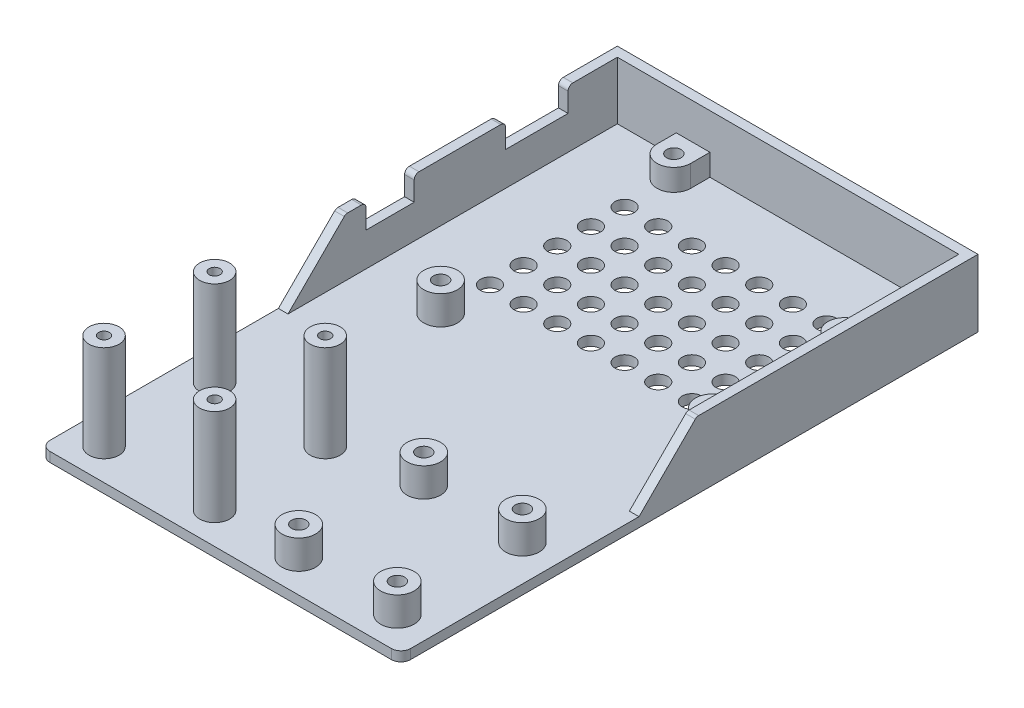
from build123d import *

# Parameters (mm, degrees)
SKETCH1_W                = 70
SKETCH1_H                = 100
BOSS_EXTRUDE1_DEPTH      = 2
SKETCH2_R                = 3.5
SKETCH2_R_2              = 1.5
BOSS_EXTRUDE2_DEPTH      = 6
BOSS_EXTRUDE3_START      = -2
SKETCH3_R                = 3.5
BOSS_EXTRUDE3_DEPTH      = 2
BOSS_EXTRUDE4_DEPTH      = 12
BOSS_EXTRUDE4_DEPTH_BACK = 2
SKETCH4_W                = 75
SKETCH4_H                = 105
SKETCH4_W_2              = 71
SKETCH4_H_2              = 101
BOSS_EXTRUDE5_DEPTH      = 6
SKETCH8_W                = 75
SKETCH8_H                = 46.5
CUT_EXTRUDE1_DEPTH       = 66.623928563
SKETCH9_W                = 2
SKETCH9_H                = 13
SKETCH9_H_2              = 10
CUT_EXTRUDE2_DEPTH       = 5
CHAMFER1_SIZE            = 12
FILLET2_START            = -38
FILLET2_DEPTH            = 73.5
FILLET2_START_2          = -35.5
FILLET2_2_DEPTH          = 73.5
SKETCH10_R               = 3.5
SKETCH10_R_2             = 1.5
BOSS_EXTRUDE6_DEPTH      = 6
SKETCH11_R               = 3.125
SKETCH11_R_2             = 1.125
BOSS_EXTRUDE7_DEPTH      = 20
SKETCH12_R               = 2
CUT_EXTRUDE3_DEPTH       = 78.034489029
SKETCH14_W               = 75
SKETCH14_H               = 15
BOSS_EXTRUDE8_DEPTH      = 2
FILLET3_R                = 2
CUT_EXTRUDE4_DEPTH       = 1.5


with BuildPart() as part:
    # Sketch1 → Boss-Extrude1 (new body)
    with BuildSketch(Plane(origin=(0, 0, 0), x_dir=(1, 0, 0), z_dir=(0, 1, 0))):
        Rectangle(SKETCH1_W, SKETCH1_H)
    extrude(amount=BOSS_EXTRUDE1_DEPTH)

    # Sketch2 → Boss-Extrude2 (add)
    # profile 1 of 4: a face of its own
    with BuildSketch(Plane(origin=(0, 2, 0), x_dir=(1, 0, 0), z_dir=(0, 1, 0))):
        with Locations(Location((-19.75, 46.5, 0), (0, 0, 90))):
            Circle(SKETCH2_R)
        with Locations(Location((-19.75, 46.5, 0), (0, 0, 270))):
            Circle(SKETCH2_R_2, mode=Mode.SUBTRACT)
    # profile 2 of 4: a face of its own
    with BuildSketch(Plane(origin=(0, 2, 0), x_dir=(1, 0, 0), z_dir=(0, 1, 0))):
        with Locations((31.5, 30.75)):
            Circle(SKETCH2_R)
        with Locations(Location((31.5, 30.75, 0), (0, 0, 270))):
            Circle(SKETCH2_R_2, mode=Mode.SUBTRACT)
    # profile 3 of 4: a face of its own
    with BuildSketch(Plane(origin=(0, 2, 0), x_dir=(1, 0, 0), z_dir=(0, 1, 0))):
        with Locations((31.5, 3.25)):
            Circle(SKETCH2_R)
        with Locations(Location((31.5, 3.25, 0), (0, 0, 270))):
            Circle(SKETCH2_R_2, mode=Mode.SUBTRACT)
    # profile 4 of 4: a face of its own
    with BuildSketch(Plane(origin=(0, 2, 0), x_dir=(1, 0, 0), z_dir=(0, 1, 0))):
        with Locations(Location((-19.75, -2, 0), (0, 0, 270))):
            Circle(SKETCH2_R)
        with Locations(Location((-19.75, -2, 0), (0, 0, 270))):
            Circle(SKETCH2_R_2, mode=Mode.SUBTRACT)
    extrude(amount=BOSS_EXTRUDE2_DEPTH)

    # Sketch3 → Boss-Extrude3 (add)
    # profile 1 of 4: a face of its own
    with BuildSketch(Plane(origin=(0, 2, 0), x_dir=(1, 0, 0), z_dir=(0, 1, 0)).offset(BOSS_EXTRUDE3_START)):
        Polygon((-19.75, 50.5), (-35.5, 50.5), (-35.5, -50.5), (35.5, -50.5), (35.5, 3.25), (35.5, 50.5), align=None)
        Polygon((35, -50), (35, 3.25), (35, 30.75), (35, 50), (-19.75, 50), (-35, 50), (-35, -50), align=None, mode=Mode.SUBTRACT)
    # profile 2 of 4: a face of its own
    with BuildSketch(Plane(origin=(0, 2, 0), x_dir=(1, 0, 0), z_dir=(0, 1, 0)).offset(BOSS_EXTRUDE3_START)):
        with Locations(Location((31.5, 3.25, 0), (0, 0, 270))):
            Circle(SKETCH3_R)
    # profile 3 of 4: a face of its own
    with BuildSketch(Plane(origin=(0, 2, 0), x_dir=(1, 0, 0), z_dir=(0, 1, 0)).offset(BOSS_EXTRUDE3_START)):
        with Locations(Location((31.5, 30.75, 0), (0, 0, 270))):
            Circle(SKETCH3_R)
    # profile 4 of 4: a face of its own
    with BuildSketch(Plane(origin=(0, 2, 0), x_dir=(1, 0, 0), z_dir=(0, 1, 0)).offset(BOSS_EXTRUDE3_START)):
        with Locations(Location((-19.75, 46.5, 0), (0, 0, 270))):
            Circle(SKETCH3_R)
    extrude(amount=BOSS_EXTRUDE3_DEPTH)

    # Sketch4 → Boss-Extrude4 (add, two sides: drawn at the far end of the back side and taken through both)
    with BuildSketch(Plane(origin=(0, 2, 0), x_dir=(1, 0, 0), z_dir=(0, 1, 0)).offset(-BOSS_EXTRUDE4_DEPTH_BACK)):
        Rectangle(SKETCH4_W, SKETCH4_H)
        Rectangle(SKETCH4_W_2, SKETCH4_H_2, mode=Mode.SUBTRACT)
    extrude(amount=BOSS_EXTRUDE4_DEPTH + BOSS_EXTRUDE4_DEPTH_BACK)

    # Sketch6 → Boss-Extrude5 (add)
    with BuildSketch(Plane(origin=(0, 2, 0), x_dir=(1, 0, 0), z_dir=(0, 1, 0))):
        with BuildLine():
            Line((31.5, -0.25), (35.5, -0.25))
            Line((35.5, -0.25), (35.5, 6.75))
            Line((35.5, 6.75), (31.5, 6.75))
            ThreePointArc((31.5, 6.75), (33.974873734, 5.724873734), (35, 3.25))
            ThreePointArc((35, 3.25), (33.974873734, 0.775126266), (31.5, -0.25))
        make_face()
        with BuildLine():
            Line((31.5, 27.25), (35.5, 27.25))
            Line((35.5, 27.25), (35.5, 34.25))
            Line((35.5, 34.25), (31.5, 34.25))
            ThreePointArc((31.5, 34.25), (33.974873734, 33.224873734), (35, 30.75))
            ThreePointArc((35, 30.75), (33.974873734, 28.275126266), (31.5, 27.25))
        make_face()
        with BuildLine():
            Line((-16.25, 46.5), (-16.25, 50.5))
            Line((-16.25, 50.5), (-23.25, 50.5))
            Line((-23.25, 50.5), (-23.25, 46.5))
            ThreePointArc((-23.25, 46.5), (-19.75, 50), (-16.25, 46.5))
        make_face()
    extrude(amount=BOSS_EXTRUDE5_DEPTH)

    # Sketch8 → Cut-Extrude1 (cut, through all)
    with BuildSketch(Plane(origin=(0, 2, 0), x_dir=(1, 0, 0), z_dir=(0, 1, 0))):
        with Locations((0, -29.25)):
            Rectangle(SKETCH8_W, SKETCH8_H)
    extrude(amount=CUT_EXTRUDE1_DEPTH, mode=Mode.SUBTRACT)

    # Sketch9 → Cut-Extrude2 (cut)
    with BuildSketch(Plane(origin=(0, 14, 0), x_dir=(1, 0, 0), z_dir=(0, 1, 0))):
        with Locations((-36.5, 33.75)):
            Rectangle(SKETCH9_W, SKETCH9_H)
        with Locations((-36.5, 3.25)):
            Rectangle(SKETCH9_W, SKETCH9_H_2)
    extrude(amount=-CUT_EXTRUDE2_DEPTH, mode=Mode.SUBTRACT)

    # Chamfer1
    chamfer1_edges = [part.edges().sort_by_distance(p)[0] for p in [
        (36.5, 2, 6),
        (-36.5, 2, 6),
    ]]
    chamfer(chamfer1_edges, length=CHAMFER1_SIZE - 0.0001)  # a hair under: the kernel refuses the full size

    # Fillet2: read off the stored shape, not the designer's step
    # Fillet2 outline → Fillet2 (cut)
    with BuildSketch(Plane.YZ.offset(FILLET2_START)):
        with BuildLine():
            Line((14, 6), (13.707106781, 6.292893219))
            ThreePointArc((13.707106781, 6.292893219), (13.923879533, 5.96846987), (14, 5.585786438))
            Line((14, 5.585786438), (14, 6))
        make_face()
        with BuildLine():
            Line((14, -41.25), (14, -40.25))
            Line((14, -40.25), (13, -40.25))
            ThreePointArc((13, -40.25), (13.707106781, -40.542893219), (14, -41.25))
        make_face()
        with BuildLine():
            Line((14, -27.25), (14, -26.25))
            ThreePointArc((14, -26.25), (13.707106781, -26.957106781), (13, -27.25))
            Line((13, -27.25), (14, -27.25))
        make_face()
        with BuildLine():
            Line((14, -9.25), (14, -8.25))
            Line((14, -8.25), (13, -8.25))
            ThreePointArc((13, -8.25), (13.707106781, -8.542893219), (14, -9.25))
        make_face()
        with BuildLine():
            Line((14, 1.75), (14, 2.75))
            ThreePointArc((14, 2.75), (13.707106781, 2.042893219), (13, 1.75))
            Line((13, 1.75), (14, 1.75))
        make_face()
    extrude(amount=FILLET2_DEPTH, mode=Mode.SUBTRACT)

    # Fillet2 2 outline → Fillet2 2 (cut)
    with BuildSketch(Plane.YZ.offset(FILLET2_START_2)):
        with BuildLine():
            Line((14, 6), (13.707106781, 6.292893219))
            ThreePointArc((13.707106781, 6.292893219), (13.923879533, 5.96846987), (14, 5.585786438))
            Line((14, 5.585786438), (14, 6))
        make_face()
    extrude(amount=FILLET2_2_DEPTH, mode=Mode.SUBTRACT)

    # Sketch10 → Boss-Extrude6 (add)
    # profile 1 of 4: a face of its own
    with BuildSketch(Plane(origin=(0, 2, 0), x_dir=(1, 0, 0), z_dir=(0, 1, 0))):
        with Locations(Location((9.5, -34.75, 0), (0, 0, 270))):
            Circle(SKETCH10_R)
        with Locations(Location((9.5, -34.75, 0), (0, 0, 270))):
            Circle(SKETCH10_R_2, mode=Mode.SUBTRACT)
    # profile 2 of 4: a face of its own
    with BuildSketch(Plane(origin=(0, 2, 0), x_dir=(1, 0, 0), z_dir=(0, 1, 0))):
        with Locations(Location((30, -34.75, 0), (0, 0, 270))):
            Circle(SKETCH10_R)
        with Locations(Location((30, -34.75, 0), (0, 0, 270))):
            Circle(SKETCH10_R_2, mode=Mode.SUBTRACT)
    # profile 3 of 4: a face of its own
    with BuildSketch(Plane(origin=(0, 2, 0), x_dir=(1, 0, 0), z_dir=(0, 1, 0))):
        with Locations(Location((30, -60.75, 0), (0, 0, 270))):
            Circle(SKETCH10_R)
        with Locations(Location((30, -60.75, 0), (0, 0, 270))):
            Circle(SKETCH10_R_2, mode=Mode.SUBTRACT)
    # profile 4 of 4: a face of its own
    with BuildSketch(Plane(origin=(0, 2, 0), x_dir=(1, 0, 0), z_dir=(0, 1, 0))):
        with Locations(Location((9.5, -60.75, 0), (0, 0, 270))):
            Circle(SKETCH10_R)
        with Locations(Location((9.5, -60.75, 0), (0, 0, 270))):
            Circle(SKETCH10_R_2, mode=Mode.SUBTRACT)
    extrude(amount=BOSS_EXTRUDE6_DEPTH)


with BuildPart() as boss_extrude6_piece_1:
    # of the separate pieces the step leaves, piece 1, a body of its own (boss_extrude6_pieces)
    add(part.part.solids().sort_by_distance((-37.5, 2, 17.9999))[0])

    # Sketch11 → Boss-Extrude7 (add)
    # profile 1 of 4: a face of its own
    with BuildSketch(Plane(origin=(0, 2, 0), x_dir=(1, 0, 0), z_dir=(0, 1, 0))):
        with Locations(Location((-30.75, -38, 0), (0, 0, 270))):
            Circle(SKETCH11_R)
        with Locations(Location((-30.75, -38, 0), (0, 0, 270))):
            Circle(SKETCH11_R_2, mode=Mode.SUBTRACT)
    # profile 2 of 4: a face of its own
    with BuildSketch(Plane(origin=(0, 2, 0), x_dir=(1, 0, 0), z_dir=(0, 1, 0))):
        with Locations(Location((-7.75, -38, 0), (0, 0, 270))):
            Circle(SKETCH11_R)
        with Locations(Location((-7.75, -38, 0), (0, 0, 270))):
            Circle(SKETCH11_R_2, mode=Mode.SUBTRACT)
    # profile 3 of 4: a face of its own
    with BuildSketch(Plane(origin=(0, 2, 0), x_dir=(1, 0, 0), z_dir=(0, 1, 0))):
        with Locations(Location((-7.75, -61, 0), (0, 0, 270))):
            Circle(SKETCH11_R)
        with Locations(Location((-7.75, -61, 0), (0, 0, 270))):
            Circle(SKETCH11_R_2, mode=Mode.SUBTRACT)
    # profile 4 of 4: a face of its own
    with BuildSketch(Plane(origin=(0, 2, 0), x_dir=(1, 0, 0), z_dir=(0, 1, 0))):
        with Locations(Location((-30.75, -61, 0), (0, 0, 270))):
            Circle(SKETCH11_R)
        with Locations(Location((-30.75, -61, 0), (0, 0, 270))):
            Circle(SKETCH11_R_2, mode=Mode.SUBTRACT)
    extrude(amount=BOSS_EXTRUDE7_DEPTH)


with BuildPart() as boss_extrude6_piece_2:
    # of the separate pieces the step leaves, piece 2, a body of its own (boss_extrude6_pieces)
    add(part.part.solids().sort_by_distance((9.5, 2, 64.25))[0])


with BuildPart() as boss_extrude6_piece_3:
    # of the separate pieces the step leaves, piece 3, a body of its own (boss_extrude6_pieces)
    add(part.part.solids().sort_by_distance((30, 2, 64.25))[0])


with BuildPart() as boss_extrude7_piece_1:
    # of the separate pieces the step leaves, piece 1, a body of its own (boss_extrude7_pieces)
    add(boss_extrude6_piece_1.part.solids().sort_by_distance((-37.5, 2, 17.9999))[0])

    # Sketch12 → Cut-Extrude3 (cut, through all)
    with BuildSketch(Plane(origin=(0, 2, 0), x_dir=(1, 0, 0), z_dir=(0, 1, 0))):
        with Locations(Location((-19.75, 36.25, 0), (0, 0, 270))):
            Circle(SKETCH12_R)
        with Locations(Location((-12.75, 36.25, 0), (0, 0, 270))):
            Circle(SKETCH12_R)
        with Locations(Location((-5.75, 36.25, 0), (0, 0, 270))):
            Circle(SKETCH12_R)
        with Locations(Location((1.25, 36.25, 0), (0, 0, 270))):
            Circle(SKETCH12_R)
        with Locations(Location((8.25, 36.25, 0), (0, 0, 270))):
            Circle(SKETCH12_R)
        with Locations(Location((15.25, 36.25, 0), (0, 0, 270))):
            Circle(SKETCH12_R)
        with Locations(Location((22.25, 36.25, 0), (0, 0, 270))):
            Circle(SKETCH12_R)
        with Locations(Location((-12.75, 29.25, 0), (0, 0, 270))):
            Circle(SKETCH12_R)
        with Locations(Location((-5.75, 29.25, 0), (0, 0, 270))):
            Circle(SKETCH12_R)
        with Locations(Location((1.25, 29.25, 0), (0, 0, 270))):
            Circle(SKETCH12_R)
        with Locations(Location((8.25, 29.25, 0), (0, 0, 270))):
            Circle(SKETCH12_R)
        with Locations(Location((15.25, 29.25, 0), (0, 0, 270))):
            Circle(SKETCH12_R)
        with Locations(Location((22.25, 29.25, 0), (0, 0, 270))):
            Circle(SKETCH12_R)
        with Locations(Location((-12.75, 22.25, 0), (0, 0, 270))):
            Circle(SKETCH12_R)
        with Locations(Location((-5.75, 22.25, 0), (0, 0, 270))):
            Circle(SKETCH12_R)
        with Locations(Location((1.25, 22.25, 0), (0, 0, 270))):
            Circle(SKETCH12_R)
        with Locations(Location((8.25, 22.25, 0), (0, 0, 270))):
            Circle(SKETCH12_R)
        with Locations(Location((15.25, 22.25, 0), (0, 0, 270))):
            Circle(SKETCH12_R)
        with Locations(Location((22.25, 22.25, 0), (0, 0, 270))):
            Circle(SKETCH12_R)
        with Locations(Location((-12.75, 15.25, 0), (0, 0, 270))):
            Circle(SKETCH12_R)
        with Locations(Location((-5.75, 15.25, 0), (0, 0, 270))):
            Circle(SKETCH12_R)
        with Locations(Location((1.25, 15.25, 0), (0, 0, 270))):
            Circle(SKETCH12_R)
        with Locations(Location((8.25, 15.25, 0), (0, 0, 270))):
            Circle(SKETCH12_R)
        with Locations(Location((15.25, 15.25, 0), (0, 0, 270))):
            Circle(SKETCH12_R)
        with Locations(Location((22.25, 15.25, 0), (0, 0, 270))):
            Circle(SKETCH12_R)
        with Locations(Location((-12.75, 8.25, 0), (0, 0, 270))):
            Circle(SKETCH12_R)
        with Locations(Location((-5.75, 8.25, 0), (0, 0, 270))):
            Circle(SKETCH12_R)
        with Locations(Location((1.25, 8.25, 0), (0, 0, 270))):
            Circle(SKETCH12_R)
        with Locations(Location((8.25, 8.25, 0), (0, 0, 270))):
            Circle(SKETCH12_R)
        with Locations(Location((15.25, 8.25, 0), (0, 0, 270))):
            Circle(SKETCH12_R)
        with Locations(Location((22.25, 8.25, 0), (0, 0, 270))):
            Circle(SKETCH12_R)
        with Locations(Location((-19.75, 29.25, 0), (0, 0, 270))):
            Circle(SKETCH12_R)
        with Locations(Location((-19.75, 22.25, 0), (0, 0, 270))):
            Circle(SKETCH12_R)
        with Locations(Location((-19.75, 15.25, 0), (0, 0, 270))):
            Circle(SKETCH12_R)
        with Locations(Location((-19.75, 8.25, 0), (0, 0, 270))):
            Circle(SKETCH12_R)
    extrude(amount=-CUT_EXTRUDE3_DEPTH, mode=Mode.SUBTRACT)

    # Sketch14 → Boss-Extrude8 (add)
    with BuildSketch(Plane(origin=(0, 2, 0), x_dir=(1, 0, 0), z_dir=(0, 1, 0))):
        with Locations((0, -60)):
            Rectangle(SKETCH14_W, SKETCH14_H)
    extrude(amount=-BOSS_EXTRUDE8_DEPTH)

    # Fillet3
    fillet3_edges = [boss_extrude7_piece_1.edges().sort_by_distance(p)[0] for p in [
        (37.5, 1, 67.5),
        (-37.5, 1, 67.5),
    ]]
    fillet(fillet3_edges, radius=FILLET3_R)

    # Sketch15 → Cut-Extrude4 (cut)
    with BuildSketch(Plane(origin=(0, 8, 0), x_dir=(1, 0, 0), z_dir=(0, 1, 0))):
        with BuildLine():
            Line((-16.25, 46.5), (-16.25, 50.5))
            Line((-16.25, 50.5), (-23.25, 50.5))
            Line((-23.25, 50.5), (-23.25, 46.5))
            ThreePointArc((-23.25, 46.5), (-19.75, 43), (-16.25, 46.5))
        make_face()
    extrude(amount=-CUT_EXTRUDE4_DEPTH, mode=Mode.SUBTRACT)


with BuildPart() as boss_extrude7_piece_2:
    # of the separate pieces the step leaves, piece 2, a body of its own (boss_extrude7_pieces)
    add(boss_extrude6_piece_1.part.solids().sort_by_distance((-30.75, 2, 64.125))[0])


with BuildPart() as boss_extrude7_piece_3:
    # of the separate pieces the step leaves, piece 3, a body of its own (boss_extrude7_pieces)
    add(boss_extrude6_piece_1.part.solids().sort_by_distance((-7.75, 2, 64.125))[0])


solid = Compound([boss_extrude6_piece_2.part, boss_extrude6_piece_3.part, boss_extrude7_piece_1.part, boss_extrude7_piece_2.part, boss_extrude7_piece_3.part])
